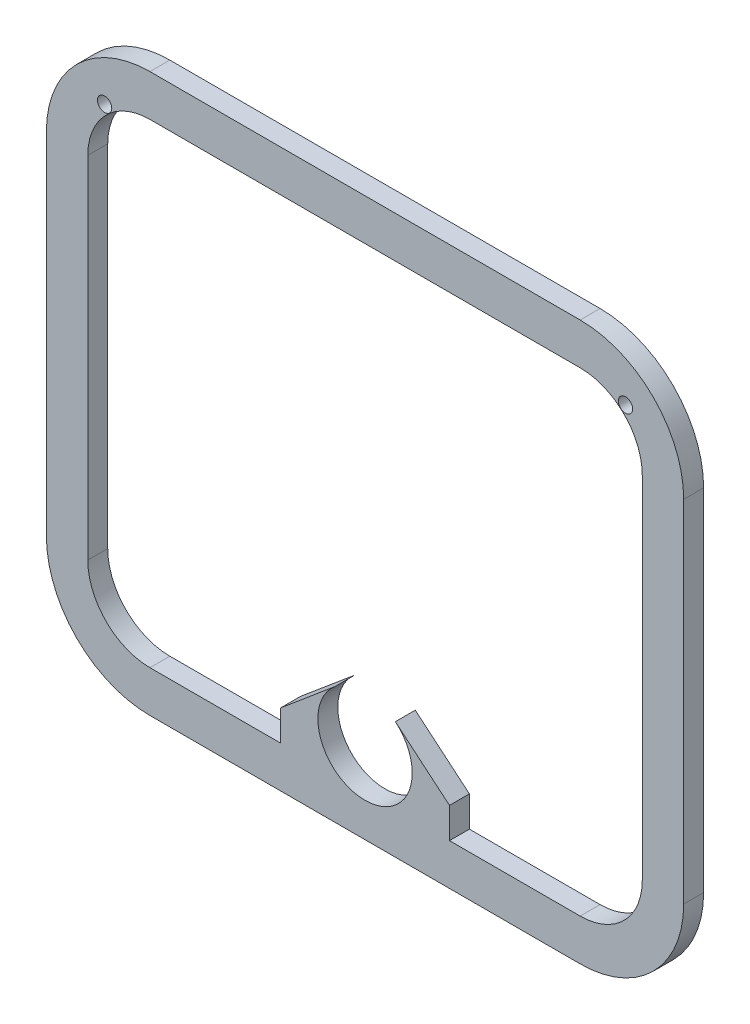
from build123d import *

# Parameters (mm, degrees)
SKETCH1_R           = 0.5715
BOSS_EXTRUDE1_DEPTH = 1.5875
CUT_EXTRUDE1_REACH  = 35.788
SKETCH2_W           = 2.901094666
SKETCH2_H           = 2.434307465


with BuildPart() as part:
    # Sketch1 → Boss-Extrude1 (new body)
    with BuildSketch(Plane.XY):
        with BuildLine():
            Line((17.145, 22.225), (-17.145, 22.225))
            ThreePointArc((-17.145, 22.225), (-22.982166479, 19.807166479), (-25.4, 13.97))
            Line((-25.4, 13.97), (-25.4, -13.97))
            ThreePointArc((-25.4, -13.97), (-22.982166479, -19.807166479), (-17.145, -22.225))
            Line((-17.145, -22.225), (17.145, -22.225))
            ThreePointArc((17.145, -22.225), (22.982166479, -19.807166479), (25.4, -13.97))
            Line((25.4, -13.97), (25.4, 13.97))
            ThreePointArc((25.4, 13.97), (22.982166479, 19.807166479), (17.145, 22.225))
        make_face()
        with Locations((-20.759611123, 18.164659732)):
            Circle(SKETCH1_R, mode=Mode.SUBTRACT)
        with Locations((20.759611123, 18.164659732)):
            Circle(SKETCH1_R, mode=Mode.SUBTRACT)
        with BuildLine():
            Line((-17.145, -18.923), (-9.632094666, -18.923))
            Line((-9.632094666, -18.923), (-2.416367182, -12.868285729))
            ThreePointArc((-2.416367182, -12.868285729), (0, -19.5072), (2.416367182, -12.868285729))
            Line((2.416367182, -12.868285729), (9.632094666, -18.923))
            Line((9.632094666, -18.923), (17.145, -18.923))
            ThreePointArc((17.145, -18.923), (20.647299887, -17.472299887), (22.098, -13.97))
            Line((22.098, -13.97), (22.098, 13.97))
            ThreePointArc((22.098, 13.97), (20.647299887, 17.472299887), (17.145, 18.923))
            Line((17.145, 18.923), (-17.145, 18.923))
            ThreePointArc((-17.145, 18.923), (-20.647299887, 17.472299887), (-22.098, 13.97))
            Line((-22.098, 13.97), (-22.098, -13.97))
            ThreePointArc((-22.098, -13.97), (-20.647299887, -17.472299887), (-17.145, -18.923))
        make_face(mode=Mode.SUBTRACT)
    extrude(amount=BOSS_EXTRUDE1_DEPTH)

    # Sketch2 → Cut-Extrude1 (cut, up to next)
    with BuildSketch(Plane.XY.offset(1.5875), mode=Mode.PRIVATE) as cut_extrude1_sk1:
        with Locations((-8.181547333, -17.705846268)):
            Rectangle(SKETCH2_W, SKETCH2_H)
    cut_extrude1_tool1 = extrude(cut_extrude1_sk1.sketch, amount=-CUT_EXTRUDE1_REACH, mode=Mode.PRIVATE) & part.part
    # Sketch2 → Cut-Extrude1 (cut, up to next)
    with BuildSketch(Plane.XY.offset(1.5875), mode=Mode.PRIVATE) as cut_extrude1_sk2:
        with Locations((8.181547333, -17.705846268)):
            Rectangle(SKETCH2_W, SKETCH2_H)
    cut_extrude1_tool2 = extrude(cut_extrude1_sk2.sketch, amount=-CUT_EXTRUDE1_REACH, mode=Mode.PRIVATE) & part.part
    add(cut_extrude1_tool1.solids().sort_by_distance((-8.181547, -17.705846, 1.5875))[0], mode=Mode.SUBTRACT)
    add(cut_extrude1_tool2.solids().sort_by_distance((8.181547, -17.705846, 1.5875))[0], mode=Mode.SUBTRACT)


solid = part.part
